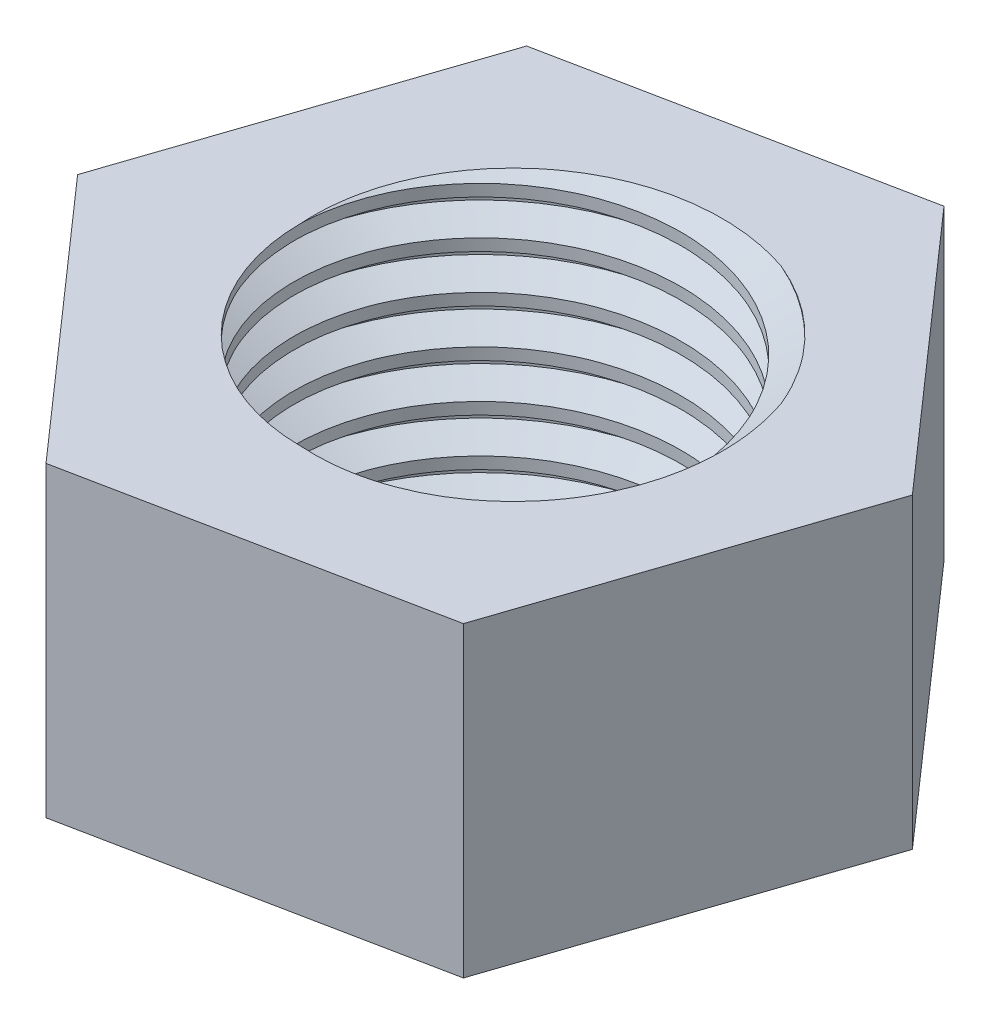
from build123d import *

# Parameters (mm, degrees)
SZKIC1_R                    = 4.1
DODANIE_WYCI_GNI_CIE1_DEPTH = 6.5
GWINT3_PITCH                = 1


with BuildPart() as part:
    # Szkic1 → Dodanie-wyciągnięcie1 (new body)
    with BuildSketch(Plane(origin=(0, 0, 0), x_dir=(1, 0, 0), z_dir=(0, 1, 0))):
        Polygon((7.357892087, 1.481471355), (2.395954215, 7.112857143), (-4.961937872, 5.631385788), (-7.357892087, -1.481471355), (-2.395954215, -7.112857143), (4.961937872, -5.631385788), align=None)
        with Locations(Location((0, 0, 0), (0, 0, 90))):
            Circle(SZKIC1_R, mode=Mode.SUBTRACT)
    extrude(amount=DODANIE_WYCI_GNI_CIE1_DEPTH)

    # Gwint3: the profile of Profil gwintu3 profile screwed along a right-hand helix of 7.5 turns, 8 arcs to a turn; built about Z, then put on its axis
    gwint3_z = Axis((0, 0, 0), (0, 0, 1))
    gwint3_corners = [(4.0997, 0, -0.000173205), (4.641265875, 0, 0.312499999), (4.641265875, 0, 0.437499999), (4.0997, 0, 0.750173202)]
    with BuildLine(mode=Mode.PRIVATE) as gwint3_profile:
        Line(gwint3_corners[0], gwint3_corners[1])
        Line(gwint3_corners[1], gwint3_corners[2])
        Line(gwint3_corners[2], gwint3_corners[3])
        Line(gwint3_corners[3], gwint3_corners[0])
    gwint3_cap = Face(gwint3_profile.wire())
    gwint3_turn_angles = [0, 22.5, 45, 67.5, 90, 112.5, 135, 157.5, 180, 202.5, 225, 247.5, 270, 292.5, 315, 337.5, 360]
    gwint3_turn_weights = [1, 0.9238795325112867, 1, 0.9238795325112867, 1, 0.9238795325112867, 1, 0.9238795325112867, 1, 0.9238795325112867, 1, 0.9238795325112867, 1, 0.9238795325112867, 1, 0.9238795325112867, 1]
    gwint3_turn_rails = [Edge.make_bspline([Vector(p[0], p[1], 0).rotate(gwint3_z, gwint3_turn_angles[k]) / gwint3_turn_weights[k] + Vector(0, 0, p[2] + GWINT3_PITCH * gwint3_turn_angles[k] / 360) for k in range(17)], [0, 0, 0, 1, 1, 2, 2, 3, 3, 4, 4, 5, 5, 6, 6, 7, 7, 8, 8, 8], 2, gwint3_turn_weights) for p in gwint3_corners]
    gwint3_turn_sides = [Face.make_surface_from_curves(gwint3_turn_rails[p[0]], gwint3_turn_rails[p[1]]) for p in [(0, 1), (1, 2), (2, 3), (3, 0)]]
    gwint3_last_angles = [2520, 2542.5, 2565, 2587.5, 2610, 2632.5, 2655, 2677.5, 2700]
    gwint3_last_weights = [1, 0.9238795325112867, 1, 0.9238795325112867, 1, 0.9238795325112867, 1, 0.9238795325112867, 1]
    gwint3_last_rails = [Edge.make_bspline([Vector(p[0], p[1], 0).rotate(gwint3_z, gwint3_last_angles[k]) / gwint3_last_weights[k] + Vector(0, 0, p[2] + GWINT3_PITCH * gwint3_last_angles[k] / 360) for k in range(9)], [0, 0, 0, 1, 1, 2, 2, 3, 3, 4, 4, 4], 2, gwint3_last_weights) for p in gwint3_corners]
    gwint3_last_sides = [Face.make_surface_from_curves(gwint3_last_rails[p[0]], gwint3_last_rails[p[1]]) for p in [(0, 1), (1, 2), (2, 3), (3, 0)]]
    gwint3 = Plane(origin=(0, -1, 0), x_dir=(1, 0, 0), z_dir=(0, 1, 0)) * Solid(Shell([*[p.moved(Location((0, 0, GWINT3_PITCH * i))) for i in range(7) for p in gwint3_turn_sides], *gwint3_last_sides, gwint3_cap, gwint3_cap.rotate(gwint3_z, 2700).moved(Location((0, 0, GWINT3_PITCH * 2700 / 360)))]))
    add(gwint3, mode=Mode.SUBTRACT)


solid = part.part
